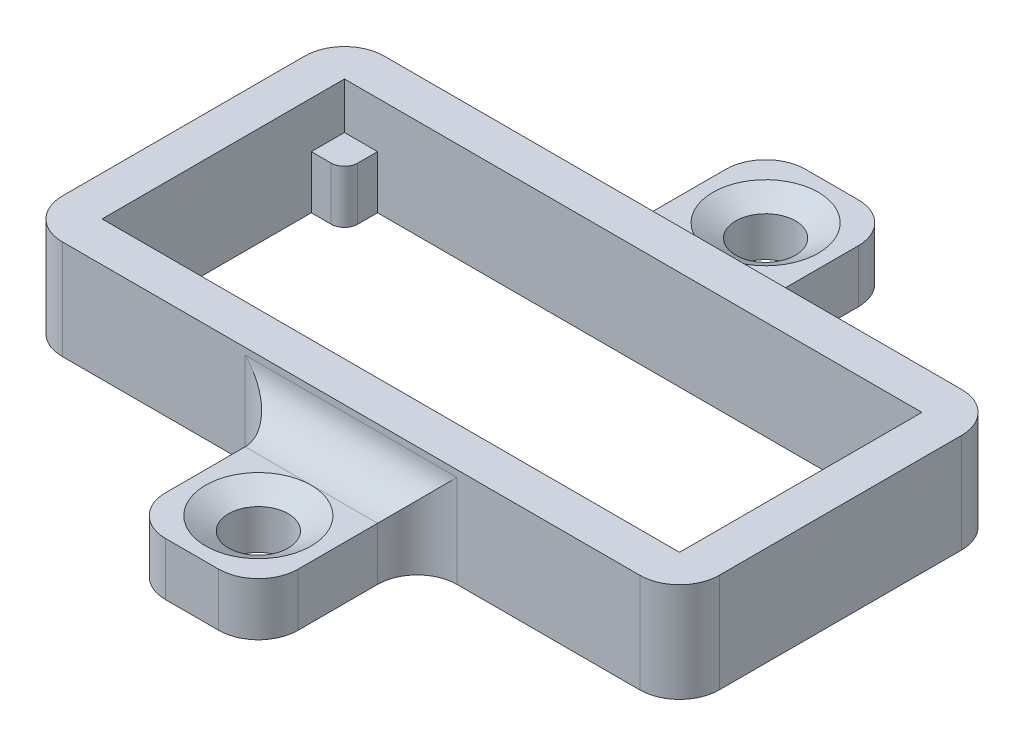
from build123d import *

# Parameters (mm, degrees)
SKETCH5_W             = 49.6
SKETCH5_H             = 24.3
SKETCH5_W_2           = 43.6
SKETCH5_H_2           = 18.3
BOSS_EXTRUDE3_DEPTH   = 7.5
FILLET1_R             = 3
SKETCH7_W             = 2.5
SKETCH7_H             = 2.5
BOSS_EXTRUDE5_DEPTH   = 4
SKETCH11_W            = 10
SKETCH11_H            = 4
BOSS_EXTRUDE6_DEPTH   = 12
FILLET3_R             = 3
SKETCH13_R            = 2.25
CUT_EXTRUDE1_DEPTH    = 56.377341937
CHAMFER2_SIZE         = 1
CHAMFER2_SIZE2        = 1.732050808
CIRPATTERN1_OUTLINE_R = 2.25
CIRPATTERN1_DEPTH     = 2.9999999
CIRPATTERN1_START     = 2.9999999
CIRPATTERN1_2_DEPTH   = 1.0000001
FILLET5_R             = 3
FILLET6_R             = 1


with BuildPart() as part:
    # Sketch5 → Boss-Extrude3 (new body)
    with BuildSketch(Plane(origin=(0, 0, 0), x_dir=(1, 0, 0), z_dir=(0, 1, 0))):
        with Locations((24.8, 12.15)):
            Rectangle(SKETCH5_W, SKETCH5_H)
        with Locations((24.8, 12.15)):
            Rectangle(SKETCH5_W_2, SKETCH5_H_2, mode=Mode.SUBTRACT)
    extrude(amount=BOSS_EXTRUDE3_DEPTH)

    # Fillet1
    fillet1_edges = [part.edges().sort_by_distance(p)[0] for p in [
        (49.6, 3.75, -24.3),
        (49.6, 3.75, 0),
        (0, 3.75, 0),
        (0, 3.75, -24.3),
    ]]
    fillet(fillet1_edges, radius=FILLET1_R)

    # Sketch7 → Boss-Extrude5 (add)
    with BuildSketch(Plane(origin=(0, 0, 0), x_dir=(1, 0, 0), z_dir=(0, 1, 0))):
        with Locations((45.35, 4.25)):
            Rectangle(SKETCH7_W, SKETCH7_H)
        with Locations((45.35, 20.05)):
            Rectangle(SKETCH7_W, SKETCH7_H)
        with Locations((4.25, 4.25)):
            Rectangle(SKETCH7_W, SKETCH7_H)
        with Locations((4.25, 20.05)):
            Rectangle(SKETCH7_W, SKETCH7_H)
    extrude(amount=BOSS_EXTRUDE5_DEPTH)

    # Sketch11 → Boss-Extrude6 (add)
    with BuildSketch(Plane.XY):
        with Locations((24.8, 2)):
            Rectangle(SKETCH11_W, SKETCH11_H)
    extrude(amount=BOSS_EXTRUDE6_DEPTH)

    # Fillet3
    fillet3_edges = [part.edges().sort_by_distance(p)[0] for p in [
        (19.8, 2, 0),
        (29.8, 2, 0),
        (24.8, 4, 0),
        (19.8, 2, 12),
        (29.8, 2, 12),
    ]]
    fillet(fillet3_edges, radius=FILLET3_R)

    # Sketch13 → Cut-Extrude1 (cut, through all)
    with BuildSketch(Plane(origin=(0, 4, 0), x_dir=(1, 0, 0), z_dir=(0, 1, 0))):
        with Locations(Location((24.8, -7, 0), (0, 0, 270))):
            Circle(SKETCH13_R)
    extrude(amount=-CUT_EXTRUDE1_DEPTH, mode=Mode.SUBTRACT)

    # Chamfer2
    chamfer2_edges = [part.edges().sort_by_distance(p)[0] for p in [
        (24.8, 4, 4.75),
    ]]
    chamfer2_side = [part.faces().sort_by_distance(p)[0] for p in [
        (24.8, 2, 4.75),
    ]]
    chamfer(chamfer2_edges, length=CHAMFER2_SIZE, length2=CHAMFER2_SIZE2, reference=chamfer2_side[0])

    # CirPattern1: read off the stored shape, not the designer's step
    # CirPattern1 outline → CirPattern1 (add)
    with BuildSketch(Plane(origin=(0, 0, 0), x_dir=(1, 0, 0), z_dir=(0, 1, 0))):
        with BuildLine():
            Line((19.8, 33.3), (19.8, 24.3))
            Line((19.8, 24.3), (29.8, 24.3))
            Line((29.8, 24.3), (29.8, 33.3))
            ThreePointArc((29.8, 33.3), (28.921320344, 35.421320344), (26.8, 36.3))
            Line((26.8, 36.3), (22.8, 36.3))
            ThreePointArc((22.8, 36.3), (20.678679656, 35.421320344), (19.8, 33.3))
        make_face()
        with Locations((24.8, 31.3)):
            Circle(CIRPATTERN1_OUTLINE_R, mode=Mode.SUBTRACT)
    extrude(amount=CIRPATTERN1_DEPTH)

    # CirPattern1 2 outline → CirPattern1 2 (add)
    with BuildSketch(Plane(origin=(0, 0, 0), x_dir=(1, 0, 0), z_dir=(0, 1, 0)).offset(CIRPATTERN1_START)):
        with BuildLine():
            Line((19.8, 33.3), (19.8, 24.3))
            Line((19.8, 24.3), (29.8, 24.3))
            Line((29.8, 24.3), (29.8, 33.3))
            ThreePointArc((29.8, 33.3), (28.921320344, 35.421320344), (26.8, 36.3))
            Line((26.8, 36.3), (22.8, 36.3))
            ThreePointArc((22.8, 36.3), (20.678679656, 35.421320344), (19.8, 33.3))
        make_face()
    extrude(amount=CIRPATTERN1_2_DEPTH)

    # CirPattern1 3 outline → CirPattern1 3 (revolve, cut)
    with BuildSketch(Plane(origin=(24.8, 0, -31.3), x_dir=(1, 0, 0), z_dir=(0, 0, 1))):
        Polygon((0, 2.9999999), (2.25, 2.9999999), (3.982050808, 4), (0, 4), align=None)
    revolve(axis=Axis((24.8, 0, -31.3), (0, 1, 0)), mode=Mode.SUBTRACT)

    # Fillet5
    fillet5_edges = [part.edges().sort_by_distance(p)[0] for p in [
        (29.8, 2, -24.3),
        (19.8, 2, -24.3),
        (24.8, 4, -24.3),
    ]]
    fillet(fillet5_edges, radius=FILLET5_R)

    # Fillet6
    fillet6_edges = [part.edges().sort_by_distance(p)[0] for p in [
        (5.5, 2, -18.8),
        (5.5, 2, -5.5),
        (44.1, 2, -5.5),
        (44.1, 2, -18.8),
    ]]
    fillet(fillet6_edges, radius=FILLET6_R)


solid = part.part
